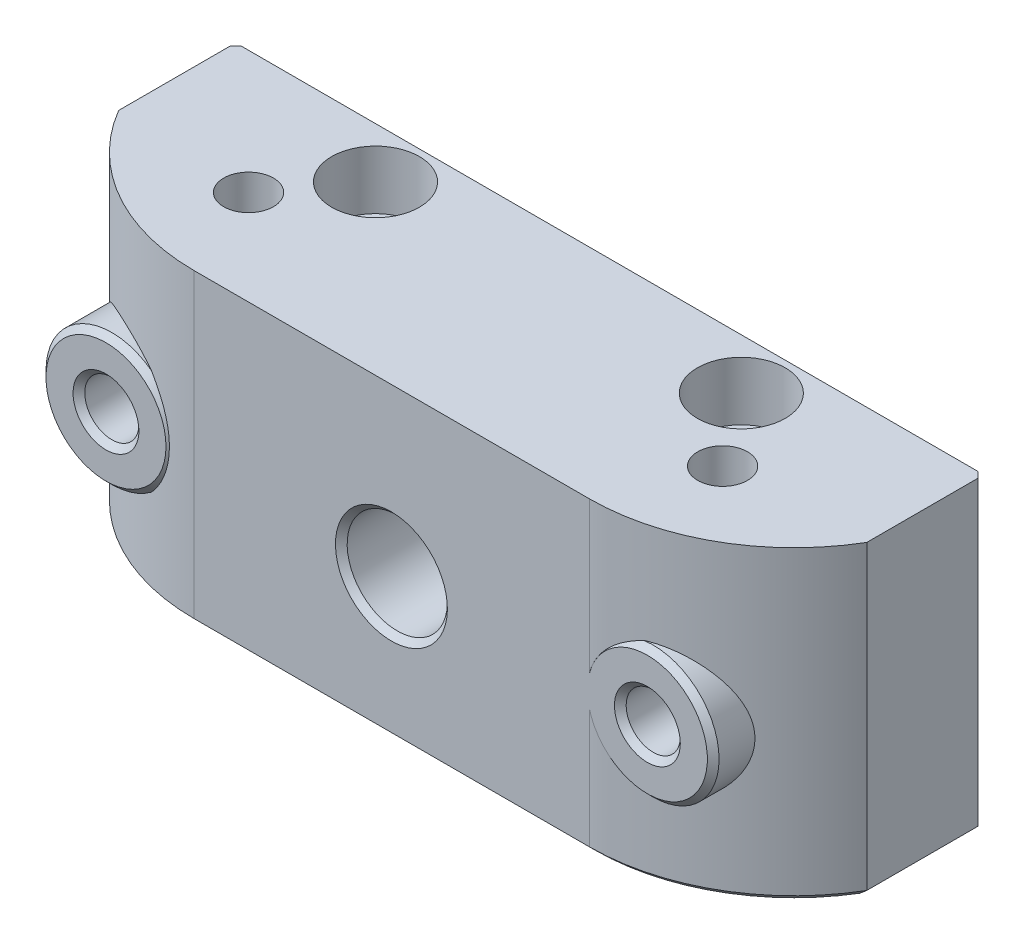
from build123d import *
from OCP.BRepAlgoAPI import BRepAlgoAPI_Cut
from OCP.TopTools import TopTools_ListOfShape

# Parameters (mm, degrees)
BOSS_EXTRUDE1_START                                 = -7.449425621
BOSS_EXTRUDE1_2_DEPTH                               = 21
BOSS_EXTRUDE1_START_2                               = 63
BOSS_EXTRUDE1_4_DEPTH                               = 12.298850431
SKETCH2_W                                           = 1.7
SKETCH2_H                                           = 2.219715696
F_8_CLEARANCE_HOLE1_D                               = 6.850000016
F_5_CLEARANCE_HOLE1_D                               = 3.7
F_5_CLEARANCE_HOLE2_D                               = 3.7
CBORE_FOR_4_BINDING_HEAD_MACHINE_SCREW1_D           = 3.4
CBORE_FOR_4_BINDING_HEAD_MACHINE_SCREW1_CBORE_D     = 6
CBORE_FOR_4_BINDING_HEAD_MACHINE_SCREW1_CBORE_DEPTH = 17
CBORE_FOR_4_BINDING_HEAD_MACHINE_SCREW2_D           = 3.4
CBORE_FOR_4_BINDING_HEAD_MACHINE_SCREW2_CBORE_D     = 6
CBORE_FOR_4_BINDING_HEAD_MACHINE_SCREW2_CBORE_DEPTH = 4
CHAMFER1_SIZE                                       = 0.4


with BuildPart() as part:
    # Boss-Extrude1: read off the stored shape, not the designer's step
    # Boss-Extrude1 outline → Boss-Extrude1 (revolve)
    with BuildSketch(Plane(origin=(17.465149993, 2.175845946, 0), x_dir=(1, 0, 0), z_dir=(0, -1, 0))):
        Polygon((4.1, 78.814325918), (0, 78.814325918), (0, 75.96128667), (4.5, 75.96128667), (4.5, 78.414325918), align=None)
    revolve(axis=Axis((17.465149993, 2.175845946, 0), (0, 0, 1)))


with BuildPart() as boss_extrude1_2_tool:
    # Boss-Extrude1 2 outline → Boss-Extrude1 2 (new body)
    with BuildSketch(Plane(origin=(0, 0, 0), x_dir=(1, 0, 0), z_dir=(0, 1, 0)).offset(BOSS_EXTRUDE1_START)):
        with BuildLine():
            Line((-25.57134053, -63.914325918), (-25.57134053, -71.914325918))
            ThreePointArc((-25.57134053, -71.914325918), (-20.455007183, -76.967517444), (-13.505121575, -78.814325918))
            Line((-13.505121575, -78.814325918), (13.49487812, -78.814325918))
            ThreePointArc((13.49487812, -78.814325918), (17.963815262, -78.081917544), (21.965177367, -75.961322696))
            ThreePointArc((21.965177367, -75.961322696), (23.960617588, -74.113292512), (25.561097982, -71.914324631))
            Line((25.561097982, -71.914324631), (25.561097225, -63.914325918))
            Line((25.561097225, -63.914325918), (-25.57134053, -63.914325918))
        make_face()
    extrude(amount=BOSS_EXTRUDE1_2_DEPTH)


with BuildPart() as part_1:
    add(part.part)


with BuildPart() as part_2:
    # Boss-Extrude1 2: joined with boss_extrude1_2_tool
    add(part_1.part.fuse(boss_extrude1_2_tool.part, tol=0.00001))


with BuildPart() as boss_extrude1_3_tool:
    # Boss-Extrude1 3 outline → Boss-Extrude1 3 (revolve)
    with BuildSketch(Plane(origin=(-19.534850007, 2.175845946, 0), x_dir=(1, 0, 0), z_dir=(0, -1, 0))):
        Polygon((0, 74.040704907), (4.5, 74.040704907), (4.5, 78.414325918), (4.1, 78.814325918), (0, 78.814325918), align=None)
    revolve(axis=Axis((-19.534850007, 2.175845946, 0), (0, 0, 1)))


with BuildPart() as part_3:
    add(part_2.part)


with BuildPart() as part_4:
    # Boss-Extrude1 3: joined with boss_extrude1_3_tool
    add(part_3.part.fuse(boss_extrude1_3_tool.part, tol=0.00001))


with BuildPart() as boss_extrude1_4_tool:
    # Boss-Extrude1 4 outline → Boss-Extrude1 4 (new body)
    with BuildSketch(Plane.XY.offset(BOSS_EXTRUDE1_START_2)):
        with BuildLine():
            Line((-25.57134053, -7.449425621), (-25.104838333, -7.449425621))
            add(Edge.make_bspline(
                [(-25.104838333, -7.449425621), (-25.334709045, -7.253368015), (-25.57134053, -7.049425621)],
                knots=[0.468951747, 0.468951747, 0.468951747, 0.559796746, 0.559796746, 0.559796746], degree=2, weights=[1.04076074, 1.043962101, 1.046874158]))
            Line((-25.57134053, -7.049425621), (-25.57134053, -7.449425621))
        make_face()
        with BuildLine():
            add(Edge.make_bspline(
                [(25.561097225, -7.049425621), (25.324465739, -7.253368015), (25.094595025, -7.449425621)],
                knots=[2.388638678, 2.388638678, 2.388638678, 2.479483677, 2.479483677, 2.479483677], degree=2, weights=[1.046874157, 1.0439621, 1.040760739]))
            Line((25.094595025, -7.449425621), (25.561097982, -7.449425621))
            Line((25.561097982, -7.449425621), (25.561097225, -7.049425621))
        make_face()
    extrude(amount=BOSS_EXTRUDE1_4_DEPTH)


with BuildPart() as part_5:
    add(part_4.part)

    # Boss-Extrude1 4: cut by boss_extrude1_4_tool, with a tolerance
    boss_extrude1_4_stock = TopTools_ListOfShape()
    boss_extrude1_4_stock.Append(part_5.part.wrapped)
    boss_extrude1_4_tools = TopTools_ListOfShape()
    boss_extrude1_4_tools.Append(boss_extrude1_4_tool.part.wrapped)
    boss_extrude1_4_cut = BRepAlgoAPI_Cut()
    boss_extrude1_4_cut.SetArguments(boss_extrude1_4_stock)
    boss_extrude1_4_cut.SetTools(boss_extrude1_4_tools)
    boss_extrude1_4_cut.SetFuzzyValue(0.00001)
    boss_extrude1_4_cut.Build()
    add(Compound.cast(boss_extrude1_4_cut.Shape()).solids(), mode=Mode.REPLACE)

    # Sketch2 → Cut-Revolve1 (revolve, cut)
    with BuildSketch(Plane.XY.offset(75.051413113)):
        with Locations((0.822643422, 7.110432227)):
            Rectangle(SKETCH2_W, SKETCH2_H)
    revolve(axis=Axis((-0.027356578, 8.220290075, 75.051413113), (0, -1, 0)), mode=Mode.SUBTRACT)

    # #8 Clearance Hole1 (through all)
    with Locations(Plane(origin=(0, 0, 63.914325918), x_dir=(-1, 0, 0), z_dir=(0, 0, -1))):
        with Locations((0.027356578, 2.190574379)):
            Hole(F_8_CLEARANCE_HOLE1_D / 2)

    # #5 Clearance Hole1 (through all)
    with Locations(Plane(origin=(0, 0, 63.914325918), x_dir=(-1, 0, 0), z_dir=(0, 0, -1))):
        with Locations((19.534850007, 2.175845946)):
            Hole(F_5_CLEARANCE_HOLE1_D / 2)

    # #5 Clearance Hole2 (through all)
    with Locations(Plane.XY.offset(78.814325918)):
        with Locations((17.465149993, 2.175845946)):
            Hole(F_5_CLEARANCE_HOLE2_D / 2)

    # CBORE for #4 Binding Head Machine Screw1 (through all)
    with Locations(Plane(origin=(0, -7.449425621, 0), x_dir=(-1, 0, 0), z_dir=(0, -1, 0))):
        with Locations((-16.117797249, -72.32547201), (16.281312789, -72.325164251)):
            CounterBoreHole(CBORE_FOR_4_BINDING_HEAD_MACHINE_SCREW1_D / 2, CBORE_FOR_4_BINDING_HEAD_MACHINE_SCREW1_CBORE_D / 2, CBORE_FOR_4_BINDING_HEAD_MACHINE_SCREW1_CBORE_DEPTH)

    # CBORE for #4 Binding Head Machine Screw2 (through all)
    with Locations(Plane(origin=(0, 13.550574379, 0), x_dir=(1, 0, 0), z_dir=(0, 1, 0))):
        with Locations((-12.56344015, -67.364326081), (12.43655985, -67.364450223)):
            CounterBoreHole(CBORE_FOR_4_BINDING_HEAD_MACHINE_SCREW2_D / 2, CBORE_FOR_4_BINDING_HEAD_MACHINE_SCREW2_CBORE_D / 2, CBORE_FOR_4_BINDING_HEAD_MACHINE_SCREW2_CBORE_DEPTH)

    # Chamfer1
    chamfer1_edges = [part_5.edges().sort_by_distance(p)[0] for p in [
        (25.561097225, 3.250574379, 63.914325918),
        (-25.57134053, 3.250574379, 63.914325918),
        (-3.452356586, 2.190574379, 78.814325918),
        (-3.452356586, 2.190574379, 63.914325918),
        (-21.384850007, 2.175845946, 78.814325918),
        (-21.384850007, 2.175845946, 63.914325918),
        (19.315149993, 2.175845946, 63.914325918),
        (19.315149993, 2.175845946, 78.814325918),
        (25.32810404, -7.249726423, 63.914325918),
        (-0.005121654, -7.449425621, 63.914325918),
        (-25.338347347, -7.249726423, 63.914325918),
        (-0.005121728, -7.449425621, 78.814325918),
        (17.963815262, -7.449425621, 78.081917544),
    ]]
    chamfer(chamfer1_edges, length=CHAMFER1_SIZE)


solid = part_5.part
